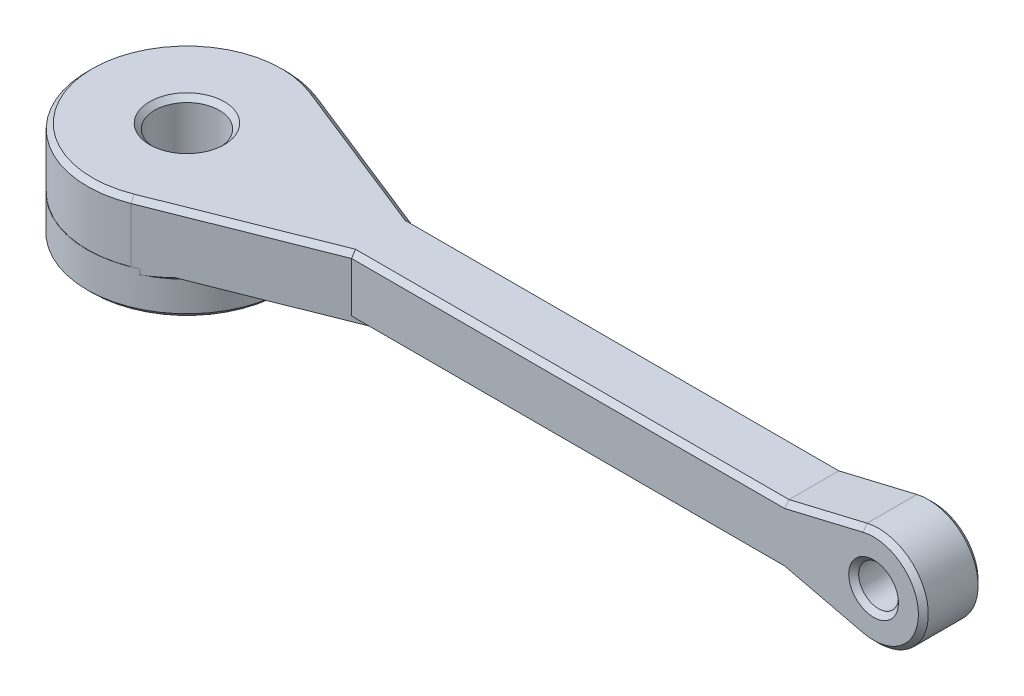
from build123d import *

# Parameters (mm, degrees)
EXTRUDE_1_DEPTH     = 3
EXTRUDE_START       = 1.5
SKETCH_2_R          = 2.5
EXTRUDE_2_DEPTH     = 3
CUT_EXTRUDE_START   = -1.5
SKETCH_3_R          = 1
CUT_EXTRUDE_1_DEPTH = 3
EXTRUDE_3_DEPTH     = 3
EXTRUDE_4_DEPTH     = 3
SKETCH_7_R          = 5.01204864
EXTRUDE_5_DEPTH     = 2
CUT_EXTRUDE_START_2 = -2
CUT_EXTRUDE_2_DEPTH = 2.5
CUT_EXTRUDE_START_3 = 3
SKETCH_9_R          = 1.625
CUT_EXTRUDE_3_DEPTH = 5
CHAMFER_3_SIZE      = 0.25


with BuildPart() as part:
    # 草图1 → 凸台-拉伸1 (new body)
    with BuildSketch(Plane(origin=(0, 0, 0), x_dir=(1, 0, 0), z_dir=(0, 1, 0))):
        with BuildLine():
            Line((36, -1.5), (36, 1.5))
            Line((36, 1.5), (4.769696007, 1.5))
            ThreePointArc((4.769696007, 1.5), (-5, 0), (4.769696007, -1.5))
            Line((4.769696007, -1.5), (36, -1.5))
        make_face()
    extrude(amount=EXTRUDE_1_DEPTH)

    # 草图2 → 凸台-拉伸2 (add)
    with BuildSketch(Plane.XY.offset(EXTRUDE_START)):
        with Locations((36, 1.5)):
            Circle(SKETCH_2_R)
    extrude(amount=-EXTRUDE_2_DEPTH)

    # 草图3 → 切除-拉伸1 (cut)
    with BuildSketch(Plane.XY.offset(CUT_EXTRUDE_START)):
        with Locations(Location((36, 1.5, 0), (0, 0, 180))):
            Circle(SKETCH_3_R)
    extrude(amount=CUT_EXTRUDE_1_DEPTH, mode=Mode.SUBTRACT)

    # 草图5 → 凸台-拉伸3 (add)
    with BuildSketch(Plane.XY.offset(EXTRUDE_START)):
        with BuildLine():
            ThreePointArc((35.421854812, 3.932231104), (34.629244055, 3.590700395), (34, 3))
            Line((34, 3), (31.5, 3))
            Line((31.5, 3), (35.421854812, 3.932231104))
        make_face()
        with BuildLine():
            ThreePointArc((34, 0), (34.629244055, -0.590700395), (35.421854812, -0.932231104))
            Line((35.421854812, -0.932231104), (31.5, 0))
            Line((31.5, 0), (34, 0))
        make_face()
    extrude(amount=-EXTRUDE_3_DEPTH)

    # 草图6 → 凸台-拉伸4 (add)
    with BuildSketch(Plane(origin=(0, 0, 0), x_dir=(1, 0, 0), z_dir=(0, 1, 0))):
        with BuildLine():
            ThreePointArc((4.769696007, 1.5), (3.662773496, 3.40354085), (1.845456766, 4.646965604))
            Line((1.845456766, 4.646965604), (9.769696007, 1.5))
            Line((9.769696007, 1.5), (4.769696007, 1.5))
        make_face()
        with BuildLine():
            ThreePointArc((1.845456766, -4.646965604), (3.662773496, -3.40354085), (4.769696007, -1.5))
            Line((4.769696007, -1.5), (9.769696007, -1.5))
            Line((9.769696007, -1.5), (1.845456766, -4.646965604))
        make_face()
    extrude(amount=EXTRUDE_4_DEPTH)

    # 草图7 → 凸台-拉伸5 (add)
    with BuildSketch(Plane(origin=(0, 0, 0), x_dir=(1, 0, 0), z_dir=(0, 1, 0))):
        with Locations(Location((0, 0, 0), (0, 0, 270))):
            Circle(SKETCH_7_R)
    extrude(amount=-EXTRUDE_5_DEPTH)

    # 草图8 → 切除-拉伸2 (cut)
    with BuildSketch(Plane(origin=(0, 0, 0), x_dir=(1, 0, 0), z_dir=(0, 1, 0)).offset(CUT_EXTRUDE_START_2)):
        Polygon((3.175426481, 0), (1.58771324, 2.75), (-1.58771324, 2.75), (-3.175426481, 0), (-1.58771324, -2.75), (1.58771324, -2.75), align=None)
    extrude(amount=CUT_EXTRUDE_2_DEPTH, mode=Mode.SUBTRACT)

    # 草图9 → 切除-拉伸3 (cut)
    with BuildSketch(Plane(origin=(0, 0, 0), x_dir=(1, 0, 0), z_dir=(0, 1, 0)).offset(CUT_EXTRUDE_START_3)):
        with Locations(Location((0, 0, 0), (0, 0, 270))):
            Circle(SKETCH_9_R)
    extrude(amount=-CUT_EXTRUDE_3_DEPTH, mode=Mode.SUBTRACT)

    # 倒角3
    # the kernel refuses this chamfer: 0.25 mm, written as the material it adds along each edge
    with BuildSketch(Plane(origin=(0, 0, 0), x_dir=(0.31362035772557234, 0, 0.949548456488706), z_dir=(-0.949548456488706, 0, 0.31362035772557234))) as chamfer_3_piece_1_section:
        Polygon((5.01204864 + CHAMFER_3_SIZE, 0), (5.01204864, -CHAMFER_3_SIZE), (5.01204864, 0), align=None)
    chamfer_3_piece_1 = revolve(axis=Axis((0, 0, 0), (0, 1, 0)), revolution_arc=143.444907743, mode=Mode.PRIVATE)
    chamfer_3_piece_1 = split(chamfer_3_piece_1, bisect_by=Plane(origin=(1.845456766, 0, 4.646965604), z_dir=(-0.3690913531117439, 0, -0.929393120836464)), keep=Keep.TOP, mode=Mode.PRIVATE)
    chamfer_3_piece_1 = split(chamfer_3_piece_1, bisect_by=Plane(origin=(1.845456766, 0, -4.646965604), z_dir=(-0.3690913531117441, 0, 0.9293931208364639)), keep=Keep.TOP, mode=Mode.PRIVATE)
    add(chamfer_3_piece_1)
    # the kernel refuses this chamfer: 0.25 mm, written as the material it takes off along each edge
    with BuildSketch(Plane(origin=(0, 3, 0), x_dir=(0, 0, 1), z_dir=(-1, 0, 0))) as chamfer_3_2_piece_1:
        Polygon((1.625 + CHAMFER_3_SIZE, 0), (1.625, -CHAMFER_3_SIZE), (1.625, 0), align=None)
    revolve(axis=Axis((0, 3, 0), (0, 1, 0)), mode=Mode.SUBTRACT)
    with BuildSketch(Plane(origin=(36, 1.5, 1.5), x_dir=(-1, 0, 0), z_dir=(0, 1, 0))) as chamfer_3_2_piece_2:
        Polygon((1 + CHAMFER_3_SIZE, 0), (1, -CHAMFER_3_SIZE), (1, 0), align=None)
    revolve(axis=Axis((36, 1.5, 1.5), (0, 0, 1)), mode=Mode.SUBTRACT)
    with BuildSketch(Plane(origin=(36, 1.5, -1.5), x_dir=(-1, 0, 0), z_dir=(0, 1, 0))) as chamfer_3_2_piece_3:
        Polygon((1, CHAMFER_3_SIZE), (1 + CHAMFER_3_SIZE, 0), (1, 0), align=None)
    revolve(axis=Axis((36, 1.5, -1.5), (0, 0, 1)), mode=Mode.SUBTRACT)
    with BuildSketch(Plane(origin=(36, 1.5, 1.5), x_dir=(-0.23125807505671483, -0.9728924414965218, 0), z_dir=(-0.9728924414965218, 0.23125807505671483, 0))) as chamfer_3_2_piece_4:
        Polygon((2.5 - CHAMFER_3_SIZE, 0), (2.5, -CHAMFER_3_SIZE), (2.5, 0), align=None)
    revolve(axis=Axis((36, 1.5, 1.5), (0, 0, 1)), revolution_arc=206.742302393, mode=Mode.SUBTRACT)
    with BuildSketch(Plane(origin=(32.142920747, 3, -1.5), x_dir=(0, 0, 1), z_dir=(-1, 0, 0))) as chamfer_3_2_piece_5_section:
        Polygon((CHAMFER_3_SIZE, 0), (0, -CHAMFER_3_SIZE), (0, 0), align=None)
    chamfer_3_2_piece_5 = extrude(amount=23.016145487, mode=Mode.PRIVATE)
    chamfer_3_2_piece_5 = split(chamfer_3_2_piece_5, bisect_by=Plane(origin=(32.15463621, 2.950713568, -1.449340307), z_dir=(-0.16352415307675153, 0.6879388427473303, -0.7071067811865444)), keep=Keep.TOP, mode=Mode.PRIVATE)
    chamfer_3_2_piece_5 = split(chamfer_3_2_piece_5, bisect_by=Plane(origin=(30.572849722, -1.253881896, 2.453528571), z_dir=(0.26098699866263353, 0.7071067811865455, -0.6571801781315938)), keep=Keep.TOP, mode=Mode.PRIVATE)
    add(chamfer_3_2_piece_5, mode=Mode.SUBTRACT)
    with BuildSketch(Plane(origin=(30.874507265, 2.851319386, -1.5), x_dir=(0, 0, 1), z_dir=(0.9728924414965218, 0.231258075056715, 0))) as chamfer_3_2_piece_6_section:
        Polygon((CHAMFER_3_SIZE, 0), (0, CHAMFER_3_SIZE), (0, 0), align=None)
    chamfer_3_2_piece_6 = extrude(amount=4.674049621, mode=Mode.PRIVATE)
    chamfer_3_2_piece_6 = split(chamfer_3_2_piece_6, bisect_by=Plane(origin=(30.874507265, 2.800659693, -1.449340307), z_dir=(0, 0.7071067811865476, -0.7071067811865476)), keep=Keep.TOP, mode=Mode.PRIVATE)
    add(chamfer_3_2_piece_6, mode=Mode.SUBTRACT)
    with BuildSketch(Plane(origin=(30.874507265, 2.851319386, 1.5), x_dir=(0.23125807505671495, -0.9728924414965217, 0), z_dir=(0.9728924414965218, 0.231258075056715, 0))) as chamfer_3_2_piece_7_section:
        Polygon((CHAMFER_3_SIZE, 0), (0, CHAMFER_3_SIZE), (0, 0), align=None)
    chamfer_3_2_piece_7 = extrude(amount=4.674049621, mode=Mode.PRIVATE)
    chamfer_3_2_piece_7 = split(chamfer_3_2_piece_7, bisect_by=Plane(origin=(30.874507265, 2.800659693, 1.449340307), z_dir=(0, 0.7071067811865476, 0.7071067811865476)), keep=Keep.TOP, mode=Mode.PRIVATE)
    add(chamfer_3_2_piece_7, mode=Mode.SUBTRACT)
    with BuildSketch(Plane(origin=(36, 1.5, -1.5), x_dir=(-0.23125807505671483, 0.9728924414965218, 0), z_dir=(-0.9728924414965218, -0.23125807505671483, 0))) as chamfer_3_2_piece_8:
        Polygon((2.5, -CHAMFER_3_SIZE), (2.5 - CHAMFER_3_SIZE, 0), (2.5, 0), align=None)
    revolve(axis=Axis((36, 1.5, -1.5), (0, 0, -1)), revolution_arc=206.742302393, mode=Mode.SUBTRACT)
    with BuildSketch(Plane(origin=(32.142920747, 0, -1.5), x_dir=(0, 0, 1), z_dir=(-1, 0, 0))) as chamfer_3_2_piece_9_section:
        Polygon((CHAMFER_3_SIZE, 0), (0, CHAMFER_3_SIZE), (0, 0), align=None)
    chamfer_3_2_piece_9 = extrude(amount=23.016145487, mode=Mode.PRIVATE)
    chamfer_3_2_piece_9 = split(chamfer_3_2_piece_9, bisect_by=Plane(origin=(29.095051535, 0, 6.174708862), z_dir=(0.3690913531117441, 0, -0.9293931208364639)), keep=Keep.TOP, mode=Mode.PRIVATE)
    chamfer_3_2_piece_9 = split(chamfer_3_2_piece_9, bisect_by=Plane(origin=(32.15463621, 0.049286432, -1.449340307), z_dir=(-0.16352415307675064, -0.6879388427473256, -0.7071067811865488)), keep=Keep.TOP, mode=Mode.PRIVATE)
    add(chamfer_3_2_piece_9, mode=Mode.SUBTRACT)
    with BuildSketch(Plane(origin=(35.421854812, -0.932231104, 1.5), x_dir=(0.23125807505671522, 0.9728924414965215, 0), z_dir=(-0.9728924414965217, 0.23125807505671525, 0))) as chamfer_3_2_piece_10_section:
        Polygon((CHAMFER_3_SIZE, 0), (0, CHAMFER_3_SIZE), (0, 0), align=None)
    chamfer_3_2_piece_10 = extrude(amount=4.674049621, mode=Mode.PRIVATE)
    chamfer_3_2_piece_10 = split(chamfer_3_2_piece_10, bisect_by=Plane(origin=(35.421854812, -0.341115552, 0.908884448), z_dir=(0, -0.7071067811865476, 0.7071067811865476)), keep=Keep.TOP, mode=Mode.PRIVATE)
    add(chamfer_3_2_piece_10, mode=Mode.SUBTRACT)
    with BuildSketch(Plane(origin=(35.421854812, -0.932231104, -1.5), x_dir=(0, 0, 1), z_dir=(-0.9728924414965217, 0.23125807505671525, 0))) as chamfer_3_2_piece_11_section:
        Polygon((CHAMFER_3_SIZE, 0), (0, CHAMFER_3_SIZE), (0, 0), align=None)
    chamfer_3_2_piece_11 = extrude(amount=4.674049621, mode=Mode.PRIVATE)
    chamfer_3_2_piece_11 = split(chamfer_3_2_piece_11, bisect_by=Plane(origin=(35.421854812, -0.341115552, -0.908884448), z_dir=(0, -0.7071067811865476, -0.7071067811865476)), keep=Keep.TOP, mode=Mode.PRIVATE)
    add(chamfer_3_2_piece_11, mode=Mode.SUBTRACT)
    with BuildSketch(Plane(origin=(0, 3, 0), x_dir=(0.36909135311174435, 0, -0.9293931208364636), z_dir=(0.9293931208364636, 0, 0.36909135311174435))) as chamfer_3_2_piece_12:
        Polygon((5 - CHAMFER_3_SIZE, 0), (5, -CHAMFER_3_SIZE), (5, 0), align=None)
    revolve(axis=Axis((0, 3, 0), (0, 1, 0)), revolution_arc=223.319179184, mode=Mode.SUBTRACT)
    with BuildSketch(Plane(origin=(1.845456766, 3, -4.646965604), x_dir=(-0.3690913531117441, 0, 0.9293931208364639), z_dir=(0.9293931208364639, 0, 0.3690913531117441))) as chamfer_3_2_piece_13_section:
        Polygon((CHAMFER_3_SIZE, 0), (0, CHAMFER_3_SIZE), (0, 0), align=None)
    chamfer_3_2_piece_13 = extrude(amount=9.169171979, mode=Mode.PRIVATE)
    chamfer_3_2_piece_13 = split(chamfer_3_2_piece_13, bisect_by=Plane(origin=(1.845456766, 1.301517198, -2.948482802), z_dir=(0, 0.7071067811865476, -0.7071067811865476)), keep=Keep.TOP, mode=Mode.PRIVATE)
    add(chamfer_3_2_piece_13, mode=Mode.SUBTRACT)
    with BuildSketch(Plane(origin=(9.12677526, 0, 1.5), x_dir=(0, 1, 0), z_dir=(1, 0, 0))) as chamfer_3_2_piece_14_section:
        Polygon((CHAMFER_3_SIZE, 0), (0, -CHAMFER_3_SIZE), (0, 0), align=None)
    chamfer_3_2_piece_14 = extrude(amount=23.016145487, mode=Mode.PRIVATE)
    chamfer_3_2_piece_14 = split(chamfer_3_2_piece_14, bisect_by=Plane(origin=(9.214359342, 0, 1.720541724), z_dir=(0.3690913531117439, 0, 0.929393120836464)), keep=Keep.TOP, mode=Mode.PRIVATE)
    chamfer_3_2_piece_14 = split(chamfer_3_2_piece_14, bisect_by=Plane(origin=(9.753945875, 2.638478895, -1.211994443), z_dir=(-0.16352415307675064, -0.6879388427473256, 0.7071067811865488)), keep=Keep.TOP, mode=Mode.PRIVATE)
    add(chamfer_3_2_piece_14, mode=Mode.SUBTRACT)
    with BuildSketch(Plane(origin=(9.12677526, 3, 1.5), x_dir=(0, -1, 0), z_dir=(1, 0, 0))) as chamfer_3_2_piece_15_section:
        Polygon((CHAMFER_3_SIZE, 0), (0, CHAMFER_3_SIZE), (0, 0), align=None)
    chamfer_3_2_piece_15 = extrude(amount=23.016145487, mode=Mode.PRIVATE)
    chamfer_3_2_piece_15 = split(chamfer_3_2_piece_15, bisect_by=Plane(origin=(9.753945875, 0.361521105, -1.211994443), z_dir=(-0.16352415307675153, 0.6879388427473303, 0.7071067811865444)), keep=Keep.TOP, mode=Mode.PRIVATE)
    chamfer_3_2_piece_15 = split(chamfer_3_2_piece_15, bisect_by=Plane(origin=(9.124430882, 2.993648244, 1.494096722), z_dir=(0.2609869986626325, 0.7071067811865481, 0.6571801781315915)), keep=Keep.TOP, mode=Mode.PRIVATE)
    add(chamfer_3_2_piece_15, mode=Mode.SUBTRACT)
    with BuildSketch(Plane(origin=(10.367222127, 3, 1.262703512), x_dir=(-0.3690913531117439, 0, -0.929393120836464), z_dir=(-0.9293931208364639, 0, 0.36909135311174385))) as chamfer_3_2_piece_16_section:
        Polygon((CHAMFER_3_SIZE, 0), (0, CHAMFER_3_SIZE), (0, 0), align=None)
    chamfer_3_2_piece_16 = extrude(amount=9.169171979, mode=Mode.PRIVATE)
    chamfer_3_2_piece_16 = split(chamfer_3_2_piece_16, bisect_by=Plane(origin=(10.367222127, 2.993648244, 1.256351756), z_dir=(0, 0.7071067811865476, 0.7071067811865476)), keep=Keep.TOP, mode=Mode.PRIVATE)
    add(chamfer_3_2_piece_16, mode=Mode.SUBTRACT)
    with BuildSketch(Plane(origin=(0, -2, 0), x_dir=(0, 0, 1), z_dir=(-1, 0, 0))) as chamfer_3_2_piece_17:
        Polygon((5.01204864, CHAMFER_3_SIZE), (5.01204864 - CHAMFER_3_SIZE, 0), (5.01204864, 0), align=None)
    revolve(axis=Axis((0, -2, 0), (0, 1, 0)), mode=Mode.SUBTRACT)


solid = part.part
